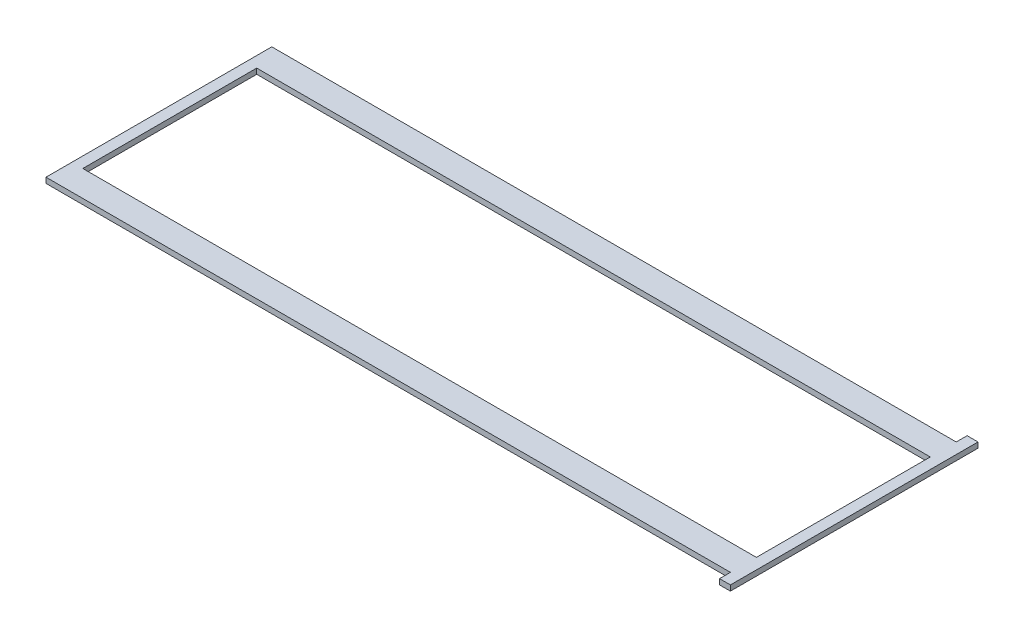
from build123d import *

# Parameters (mm, degrees)
SKETCH1_W           = 393.7
SKETCH1_H           = 101.6508
BOSS_EXTRUDE1_DEPTH = 3.175


with BuildPart() as part:
    # Sketch1 → Boss-Extrude1 (new body)
    with BuildSketch(Plane(origin=(0, 0, 0), x_dir=(1, 0, 0), z_dir=(0, 1, 0))):
        Polygon((196.85, -65.986025), (196.85, -72.361425), (203.2, -72.361425), (203.2, 72.361425), (196.85, 72.361425), (196.85, 65.986025), (-203.2, 65.986025), (-203.2, -65.986025), align=None)
        Rectangle(SKETCH1_W, SKETCH1_H, mode=Mode.SUBTRACT)
    extrude(amount=BOSS_EXTRUDE1_DEPTH)


solid = part.part
